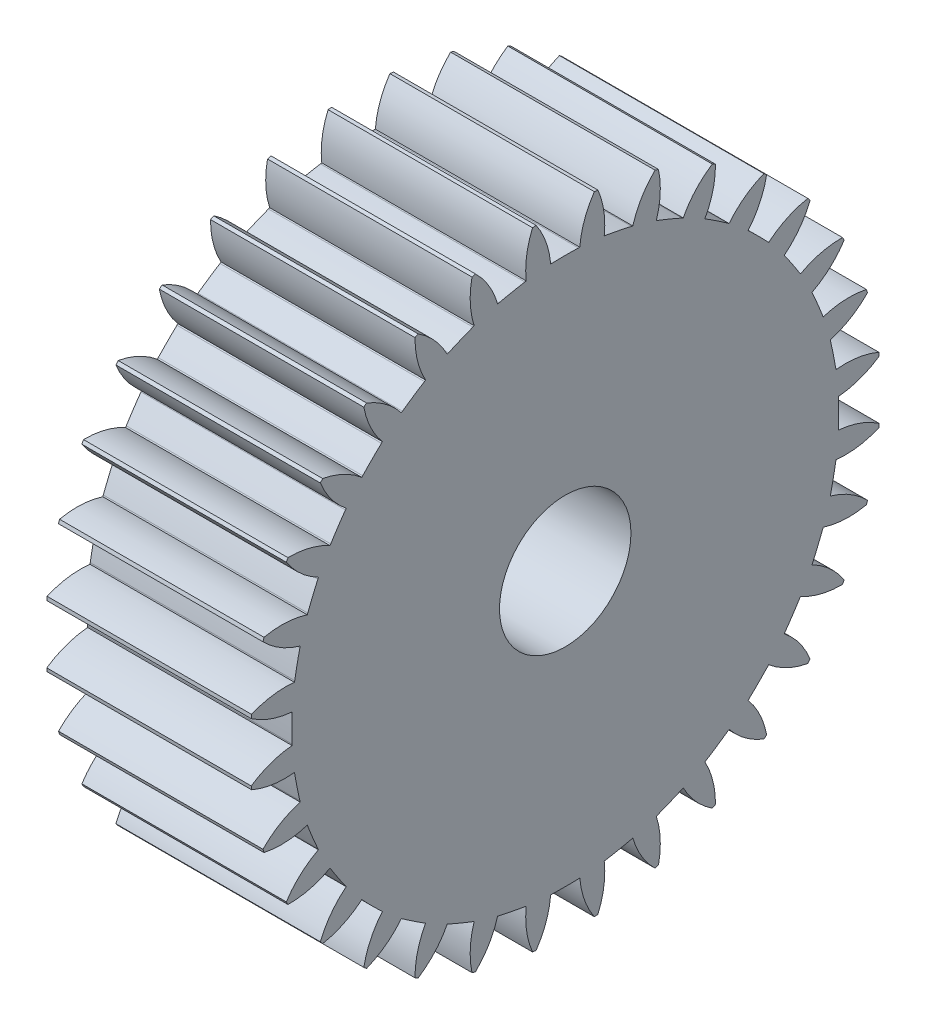
from build123d import *

# Parameters (mm, degrees)
SKETCH1_R                = 107.95
BOSS_EXTRUDE1_DEPTH      = 35
SKETCH6_R                = 22.5
CUT_EXTRUDE4_DEPTH       = 168.947625765
CUT_EXTRUDE5_DEPTH       = 168.947625765
FILLET1_R                = 170
CIRPATTERN1_COUNT        = 32
FILLET1_OF_CIRPATTERN1_R = 170


with BuildPart() as part:
    # Sketch1 → Boss-Extrude1 (new, symmetric)
    with BuildSketch(Plane(origin=(0, 0, 0), x_dir=(0, 0, -1), z_dir=(1, 0, 0))):
        Circle(SKETCH1_R)
    extrude(amount=BOSS_EXTRUDE1_DEPTH, both=True)

    # Sketch6 → Cut-Extrude4 (cut, through all)
    with BuildSketch(Plane(origin=(35, 0, 0), x_dir=(0, 0, -1), z_dir=(1, 0, 0))):
        Circle(SKETCH6_R)
    extrude(amount=-CUT_EXTRUDE4_DEPTH, mode=Mode.SUBTRACT)

    # Sketch7 → Cut-Extrude5 (cut, through all)
    with BuildSketch(Plane(origin=(35, 0, 0), x_dir=(0, 0, -1), z_dir=(1, 0, 0))):
        with BuildLine():
            Line((0, 93.65), (-4.985, 93.51722983))
            ThreePointArc((-4.985, 93.51722983), (-6.569821893, 100.827777506), (-9.975, 107.488147602))
            Line((-9.975, 107.488147602), (0, 118.932168178))
            Line((0, 118.932168178), (9.975, 107.488147602))
            ThreePointArc((9.975, 107.488147602), (6.569821893, 100.827777506), (4.985, 93.51722983))
            Line((4.985, 93.51722983), (0, 93.65))
        make_face()
    cut_extrude5 = extrude(amount=-CUT_EXTRUDE5_DEPTH, mode=Mode.SUBTRACT)

    # Fillet1
    # the kernel refuses this fillet: 170 mm, written as the material it takes off along each edge
    with BuildSketch(Plane(origin=(46.319422753, 93.65, 0), x_dir=(0, -0.026624494301434137, -0.9996455053183568), z_dir=(-1, 0, 0))) as fillet1_piece_1:
        with BuildLine():
            CenterArc((FILLET1_R * 0.0266339358901, FILLET1_R), FILLET1_R, 266.948697124, 3.051302876)
            Line((-FILLET1_R * 0.0265961762295, FILLET1_R * 0.00141772739361), (0, 0))
            Line((0, 0), (FILLET1_R * 0.0266339358901, 0))
        make_face()
    extrude(amount=92.638845507, mode=Mode.SUBTRACT)

    # CirPattern1: Cut-Extrude5 ×32 about axis
    cirpattern1_axis = Axis((0, 0, 0), (1, 0, 0))
    for i in range(1, CIRPATTERN1_COUNT):
        add(cut_extrude5.rotate(cirpattern1_axis, i * 360 / CIRPATTERN1_COUNT), mode=Mode.SUBTRACT)

    # Fillet1 of CirPattern1
    # the kernel refuses this fillet: 170 mm, written as the material it takes off along each edge
    with BuildSketch(Plane(origin=(46.319422753, 91.85054151, 18.270208657), x_dir=(0, -0.2211340756435523, 0.975243416070712), z_dir=(-1, 0, 0)), Plane(origin=(46.319422753, 86.52131822, 35.838303441), x_dir=(0, -0.40714559847211534, 0.9133632692662778), z_dir=(-1, 0, 0)), Plane(origin=(46.319422753, 77.867129192, 52.029152322), x_dir=(0, -0.5775107442812761, 0.8163830842439634), z_dir=(-1, 0, 0)), Plane(origin=(46.319422753, 66.220550058, 66.220550058), x_dir=(0, -0.7256824760594688, 0.6880297551270574), z_dir=(-1, 0, 0)), Plane(origin=(46.319422753, 52.029152322, 77.867129192), x_dir=(0, -0.8459666372501108, 0.5332358283721561), z_dir=(-1, 0, 0)), Plane(origin=(46.319422753, 35.838303441, 86.52131822), x_dir=(0, -0.9337407749947877, 0.3579499477750111), z_dir=(-1, 0, 0)), Plane(origin=(46.319422753, 18.270208657, 91.85054151), x_dir=(0, -0.9856317784042757, 0.16890825142551477), z_dir=(-1, 0, 0)), Plane(origin=(46.319422753, 0, 93.65), x_dir=(0, -0.9996455053183568, -0.026624494301430993), z_dir=(-1, 0, 0)), Plane(origin=(46.319422753, -18.270208657, 91.85054151), x_dir=(0, -0.975243416070712, -0.2211340756435523), z_dir=(-1, 0, 0)), Plane(origin=(46.319422753, -35.838303441, 86.52131822), x_dir=(0, -0.9133632692662778, -0.40714559847211534), z_dir=(-1, 0, 0)), Plane(origin=(46.319422753, -52.029152322, 77.867129192), x_dir=(0, -0.816383084243963, -0.577510744281277), z_dir=(-1, 0, 0)), Plane(origin=(46.319422753, -66.220550058, 66.220550058), x_dir=(0, -0.6880297551270567, -0.7256824760594695), z_dir=(-1, 0, 0)), Plane(origin=(46.319422753, -77.867129192, 52.029152322), x_dir=(0, -0.5332358283721575, -0.8459666372501098), z_dir=(-1, 0, 0)), Plane(origin=(46.319422753, -86.52131822, 35.838303441), x_dir=(0, -0.3579499477750141, -0.9337407749947866), z_dir=(-1, 0, 0)), Plane(origin=(46.319422753, -91.85054151, 18.270208657), x_dir=(0, -0.16890825142551472, -0.9856317784042755), z_dir=(-1, 0, 0)), Plane(origin=(46.319422753, -93.65, 0), x_dir=(0, 0.026624494301430997, -0.9996455053183569), z_dir=(-1, 0, 0)), Plane(origin=(46.319422753, -91.85054151, -18.270208657), x_dir=(0, 0.2211340756435523, -0.975243416070712), z_dir=(-1, 0, 0)), Plane(origin=(46.319422753, -86.52131822, -35.838303441), x_dir=(0, 0.40714559847212234, -0.9133632692662748), z_dir=(-1, 0, 0)), Plane(origin=(46.319422753, -77.867129192, -52.029152322), x_dir=(0, 0.5775107442812898, -0.8163830842439539), z_dir=(-1, 0, 0)), Plane(origin=(46.319422753, -66.220550058, -66.220550058), x_dir=(0, 0.7256824760594687, -0.6880297551270574), z_dir=(-1, 0, 0)), Plane(origin=(46.319422753, -52.029152322, -77.867129192), x_dir=(0, 0.8459666372501089, -0.533235828372159), z_dir=(-1, 0, 0)), Plane(origin=(46.319422753, -35.838303441, -86.52131822), x_dir=(0, 0.9337407749947866, -0.3579499477750141), z_dir=(-1, 0, 0)), Plane(origin=(46.319422753, -18.270208657, -91.85054151), x_dir=(0, 0.9856317784042752, -0.16890825142551794), z_dir=(-1, 0, 0)), Plane(origin=(46.319422753, 0, -93.65), x_dir=(0, 0.9996455053183568, 0.026624494301430997), z_dir=(-1, 0, 0)), Plane(origin=(46.319422753, 18.270208657, -91.85054151), x_dir=(0, 0.975243416070712, 0.2211340756435523), z_dir=(-1, 0, 0)), Plane(origin=(46.319422753, 35.838303441, -86.52131822), x_dir=(0, 0.9133632692662776, 0.40714559847211595), z_dir=(-1, 0, 0)), Plane(origin=(46.319422753, 52.029152322, -77.867129192), x_dir=(0, 0.816383084243965, 0.5775107442812741), z_dir=(-1, 0, 0)), Plane(origin=(46.319422753, 66.220550058, -66.220550058), x_dir=(0, 0.6880297551270615, 0.7256824760594649), z_dir=(-1, 0, 0)), Plane(origin=(46.319422753, 77.867129192, -52.029152322), x_dir=(0, 0.533235828372159, 0.8459666372501089), z_dir=(-1, 0, 0)), Plane(origin=(46.319422753, 86.52131822, -35.838303441), x_dir=(0, 0.3579499477750138, 0.9337407749947866), z_dir=(-1, 0, 0)), Plane(origin=(46.319422753, 91.85054151, -18.270208657), x_dir=(0, 0.16890825142551485, 0.9856317784042755), z_dir=(-1, 0, 0))) as fillet1_of_cirpattern1_piece_1:
        with BuildLine():
            CenterArc((FILLET1_OF_CIRPATTERN1_R * 0.0266339358901, -FILLET1_OF_CIRPATTERN1_R), FILLET1_OF_CIRPATTERN1_R, 90, 3.051302876)
            Line((-FILLET1_OF_CIRPATTERN1_R * 0.0265961762295, -FILLET1_OF_CIRPATTERN1_R * 0.00141772739361), (0, 0))
            Line((0, 0), (FILLET1_OF_CIRPATTERN1_R * 0.0266339358901, 0))
        make_face()
    extrude(amount=92.638845507, mode=Mode.SUBTRACT)


solid = part.part
